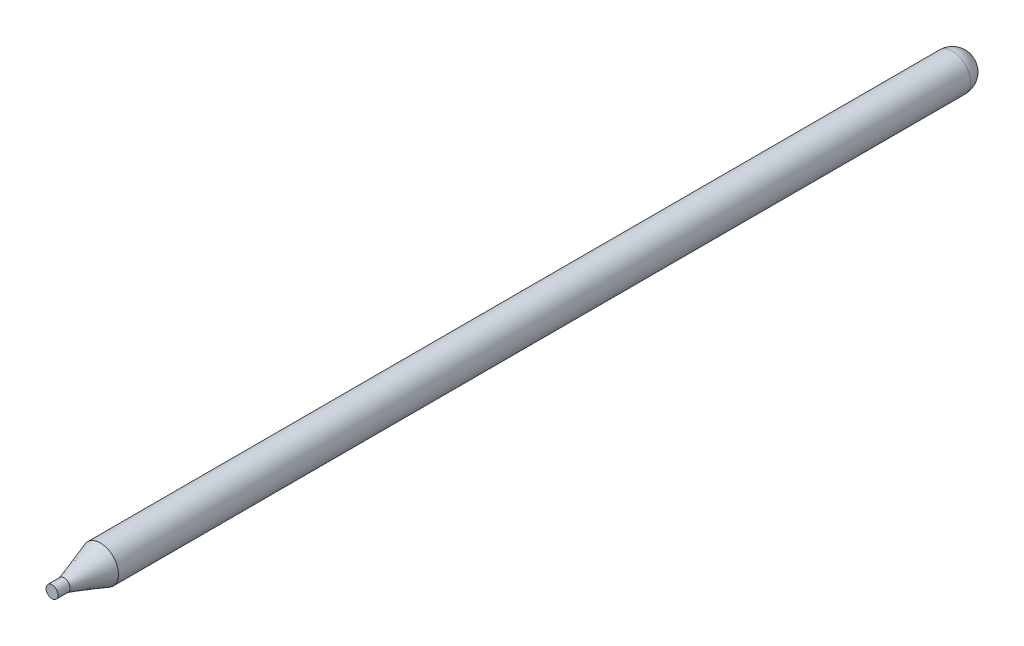
from build123d import *

# Parameters (mm, degrees)
CROQUIS3_R              = 3
SALIENTE_EXTRUIR2_DEPTH = 144
REDONDEO2_R             = 3
CROQUIS6_R              = 1
SALIENTE_EXTRUIR3_DEPTH = 2


with BuildPart() as part:
    # Croquis3 → Saliente-Extruir2 (new body)
    with BuildSketch(Plane.XY):
        Circle(CROQUIS3_R)
    extrude(amount=SALIENTE_EXTRUIR2_DEPTH)

    # Redondeo2
    redondeo2_edges = [part.edges().sort_by_distance(p)[0] for p in [
        (-3, 0, 0),
    ]]
    fillet(redondeo2_edges, radius=REDONDEO2_R)

    # Recubrir2: read off the stored shape, not the designer's step
    # Recubrir2: loft between two sections, ruled curve by curve
    recubrir2_from = [
        Edge.make_bspline([(-0.049268062, 0.998785592, 150), (1.948303122, 1.097321715, 150), (2.046839245, -0.900249468, 150), (0.049268062, -0.998785592, 150), (-1.948303122, -1.097321715, 150), (-2.046839245, 0.900249468, 150), (-0.049268062, 0.998785592, 150)], [0, 0, 0, 0, 0.5, 0.5, 0.5, 1, 1, 1, 1], 3, [1, 0.333333333, 0.333333333, 1, 0.333333333, 0.333333333, 1]),
    ]
    recubrir2_to = [
        Edge.make_bspline([(-1.18105567, 2.757735938, 144), (4.334416207, 5.119847278, 144), (6.696527546, -0.395624599, 144), (1.18105567, -2.757735938, 144), (-4.334416207, -5.119847278, 144), (-6.696527546, 0.395624599, 144), (-1.18105567, 2.757735938, 144)], [0, 0, 0, 0, 0.5, 0.5, 0.5, 1, 1, 1, 1], 3, [1, 0.333333333, 0.333333333, 1, 0.333333333, 0.333333333, 1]),
    ]
    recubrir2 = Solid(Shell([*[Face.make_surface_from_curves(recubrir2_from[k], recubrir2_to[k]) for k in range(1)], Face(Wire(recubrir2_from)), Face(Wire(recubrir2_to))]))
    add(recubrir2)

    # Croquis6 → Saliente-Extruir3 (add)
    with BuildSketch(Plane.XY.offset(150)):
        with Locations(Location((0, 0, 0), (0, 0, 92.823995247))):
            Circle(CROQUIS6_R)
    extrude(amount=SALIENTE_EXTRUIR3_DEPTH)


solid = part.part
